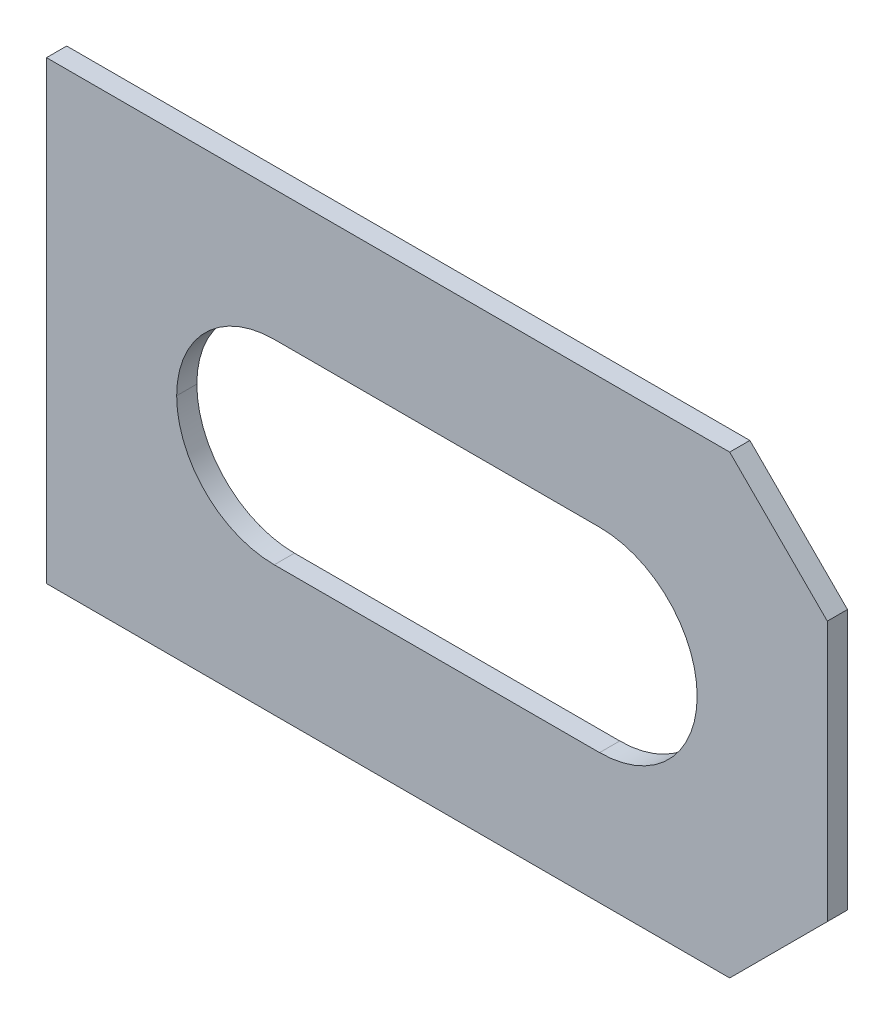
from build123d import *

# Parameters (mm, degrees)
SKETCH1_W           = 120
SKETCH1_H           = 70
SKETCH1_W_2         = 80
SKETCH1_H_2         = 30
BOSS_EXTRUDE1_DEPTH = 3.1
FILLET1_R           = 15
CHAMFER1_SIZE       = 15


with BuildPart() as part:
    # Sketch1 → Boss-Extrude1 (new body)
    with BuildSketch(Plane.XY):
        Rectangle(SKETCH1_W, SKETCH1_H)
        Rectangle(SKETCH1_W_2, SKETCH1_H_2, mode=Mode.SUBTRACT)
    extrude(amount=BOSS_EXTRUDE1_DEPTH)

    # Fillet1
    fillet1_edges = [part.edges().sort_by_distance(p)[0] for p in [
        (40, -15, 1.55),
        (40, 15, 1.55),
        (-40, 15, 1.55),
        (-40, -15, 1.55),
    ]]
    fillet(fillet1_edges, radius=FILLET1_R - 0.0001)  # a hair under: the kernel refuses the full size

    # Chamfer1
    chamfer1_edges = [part.edges().sort_by_distance(p)[0] for p in [
        (60, -35, 1.55),
        (60, 35, 1.55),
    ]]
    chamfer(chamfer1_edges, length=CHAMFER1_SIZE)


solid = part.part
